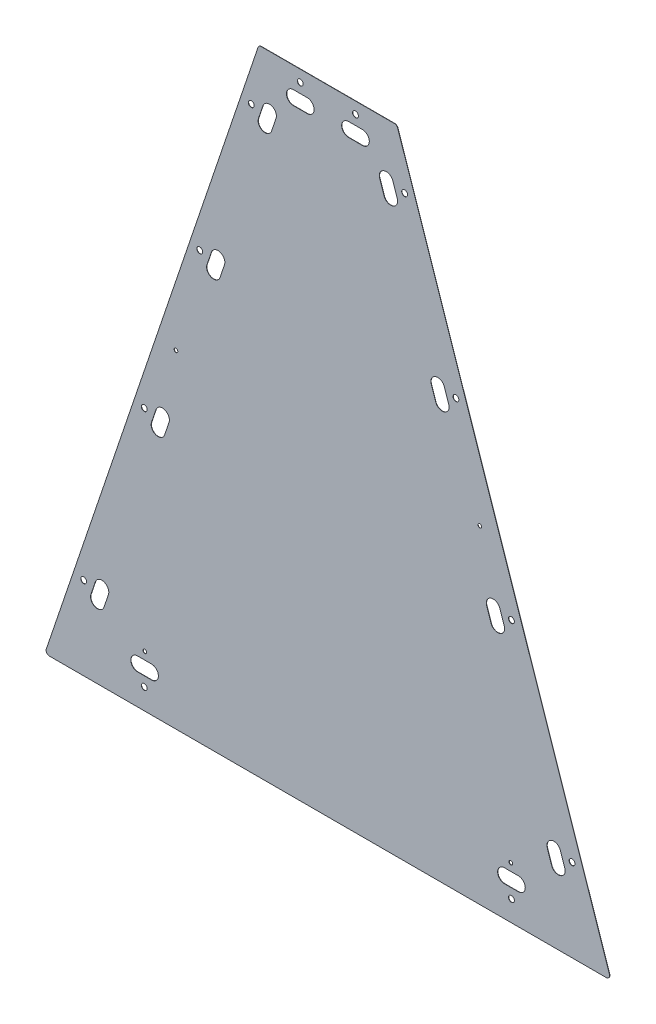
from build123d import *

# Parameters (mm, degrees)
GE_24334_OUTLINE_R   = 5.3578125
GE_24334_OUTLINE_R_2 = 3.373501
GE_24334_DEPTH       = 6.35
SKETCH1_W            = 1036.405519013
SKETCH1_H            = 5.842
CUT_EXTRUDE1_DEPTH   = 1400.059095494


# Read off the part's stored shape, not the designer's step: GE-24334
with BuildPart() as part:
    # GE-24334 outline → GE-24334 (new body)
    with BuildSketch(Plane.XY):
        with BuildLine():
            ThreePointArc((133.104268735, 292.971606529), (129.401623275, 291.780377371), (127.088174424, 288.653627505))
            Line((127.088174424, 288.653627505), (-262.322220882, -864.25261299))
            ThreePointArc((-262.322220882, -864.25261299), (-261.464897413, -869.987279425), (-256.306126571, -872.634633965))
            Line((-256.306126571, -872.634633965), (767.399392442, -872.634633965))
            ThreePointArc((767.399392442, -872.634633965), (772.558163284, -869.987279425), (773.415486753, -864.25261299))
            Line((773.415486753, -864.25261299), (384.005091446, 288.653627505))
            ThreePointArc((384.005091446, 288.653627505), (381.691642596, 291.780377371), (377.988997136, 292.971606529))
            Line((377.988997136, 292.971606529), (133.104268735, 292.971606529))
        make_face()
        with BuildLine():
            Line((-180.239726648, -736.327985402), (-172.111642745, -712.26360816))
            ThreePointArc((-172.111642745, -712.26360816), (-156.015412172, -704.29546149), (-148.047265502, -720.391692063))
            Line((-148.047265502, -720.391692063), (-156.175349405, -744.456069305))
            ThreePointArc((-156.175349405, -744.456069305), (-172.271579978, -752.424215975), (-180.239726648, -736.327985402))
        make_face(mode=Mode.SUBTRACT)
        with Locations((-82.126785136, -834.534633965)):
            Circle(GE_24334_OUTLINE_R, mode=Mode.SUBTRACT)
        with BuildLine():
            Line((-94.231734473, -791.354633965), (-68.831734473, -791.354633965))
            ThreePointArc((-68.831734473, -791.354633965), (-56.131734473, -804.054633965), (-68.831734473, -816.754633965))
            Line((-68.831734473, -816.754633965), (-94.231734473, -816.754633965))
            ThreePointArc((-94.231734473, -816.754633965), (-106.931734473, -804.054633965), (-94.231734473, -791.354633965))
        make_face(mode=Mode.SUBTRACT)
        with Locations((-81.003367065, -777.384633965)):
            Circle(GE_24334_OUTLINE_R_2, mode=Mode.SUBTRACT)
        with Locations((-193.570796303, -720.234633965)):
            Circle(GE_24334_OUTLINE_R, mode=Mode.SUBTRACT)
        with Locations((-82.126785136, -390.288393471)):
            Circle(GE_24334_OUTLINE_R, mode=Mode.SUBTRACT)
        with BuildLine():
            Line((-68.772097635, -406.311820835), (-60.644013732, -382.247443592))
            ThreePointArc((-60.644013732, -382.247443592), (-44.54778316, -374.279296923), (-36.57963649, -390.375527495))
            Line((-36.57963649, -390.375527495), (-44.707720392, -414.439904738))
            ThreePointArc((-44.707720392, -414.439904738), (-60.803950965, -422.408051408), (-68.772097635, -406.311820835))
        make_face(mode=Mode.SUBTRACT)
        with Locations((593.220051006, -834.534633965)):
            Circle(GE_24334_OUTLINE_R, mode=Mode.SUBTRACT)
        with BuildLine():
            Line((580.520051006, -791.354633965), (605.920051006, -791.354633965))
            ThreePointArc((605.920051006, -791.354633965), (618.620051006, -804.054633965), (605.920051006, -816.754633965))
            Line((605.920051006, -816.754633965), (580.520051006, -816.754633965))
            ThreePointArc((580.520051006, -816.754633965), (567.820051006, -804.054633965), (580.520051006, -791.354633965))
        make_face(mode=Mode.SUBTRACT)
        with Locations((592.096632935, -777.384633965)):
            Circle(GE_24334_OUTLINE_R_2, mode=Mode.SUBTRACT)
        with BuildLine():
            Line((667.268615276, -744.456069305), (659.140531373, -720.391692063))
            ThreePointArc((659.140531373, -720.391692063), (667.108678043, -704.29546149), (683.204908616, -712.26360816))
            Line((683.204908616, -712.26360816), (691.332992518, -736.327985402))
            ThreePointArc((691.332992518, -736.327985402), (683.364845849, -752.424215975), (667.268615276, -744.456069305))
        make_face(mode=Mode.SUBTRACT)
        with Locations((704.664062174, -720.234633965)):
            Circle(GE_24334_OUTLINE_R, mode=Mode.SUBTRACT)
        with BuildLine():
            Line((555.800986263, -414.439904738), (547.67290236, -390.375527495))
            ThreePointArc((547.67290236, -390.375527495), (555.64104903, -374.279296923), (571.737279603, -382.247443592))
            Line((571.737279603, -382.247443592), (579.865363506, -406.311820835))
            ThreePointArc((579.865363506, -406.311820835), (571.897216836, -422.408051408), (555.800986263, -414.439904738))
        make_face(mode=Mode.SUBTRACT)
        with Locations((593.220051006, -390.288393471)):
            Circle(GE_24334_OUTLINE_R, mode=Mode.SUBTRACT)
        with Locations((-23.853367065, -269.384633965)):
            Circle(GE_24334_OUTLINE_R_2, mode=Mode.SUBTRACT)
        with Locations((19.96580657, -88.028393471)):
            Circle(GE_24334_OUTLINE_R, mode=Mode.SUBTRACT)
        with BuildLine():
            Line((33.202373314, -104.401534553), (41.330457217, -80.33715731))
            ThreePointArc((41.330457217, -80.33715731), (57.42668779, -72.36901064), (65.394834459, -88.465241213))
            Line((65.394834459, -88.465241213), (57.266750557, -112.529618456))
            ThreePointArc((57.266750557, -112.529618456), (41.170519984, -120.497765125), (33.202373314, -104.401534553))
        make_face(mode=Mode.SUBTRACT)
        with Locations((114.659199441, 192.325199783)):
            Circle(GE_24334_OUTLINE_R, mode=Mode.SUBTRACT)
        with BuildLine():
            Line((127.949253412, 176.110415433), (136.077337315, 200.174792676))
            ThreePointArc((136.077337315, 200.174792676), (152.173567887, 208.142939345), (160.141714557, 192.046708773))
            Line((160.141714557, 192.046708773), (152.013630654, 167.98233153))
            ThreePointArc((152.013630654, 167.98233153), (135.917400081, 160.01418486), (127.949253412, 176.110415433))
        make_face(mode=Mode.SUBTRACT)
        with BuildLine():
            Line((192.113515822, 253.947158802), (217.513515822, 253.947158802))
            ThreePointArc((217.513515822, 253.947158802), (230.213515822, 241.247158802), (217.513515822, 228.547158802))
            Line((217.513515822, 228.547158802), (192.113515822, 228.547158802))
            ThreePointArc((192.113515822, 228.547158802), (179.413515822, 241.247158802), (192.113515822, 253.947158802))
        make_face(mode=Mode.SUBTRACT)
        with Locations((204.746632935, 271.727158802)):
            Circle(GE_24334_OUTLINE_R, mode=Mode.SUBTRACT)
        with BuildLine():
            Line((453.826515314, -112.529618456), (445.698431411, -88.465241213))
            ThreePointArc((445.698431411, -88.465241213), (453.666578081, -72.36901064), (469.762808654, -80.33715731))
            Line((469.762808654, -80.33715731), (477.890892557, -104.401534553))
            ThreePointArc((477.890892557, -104.401534553), (469.922745887, -120.497765125), (453.826515314, -112.529618456))
        make_face(mode=Mode.SUBTRACT)
        with Locations((491.127459301, -88.028393471)):
            Circle(GE_24334_OUTLINE_R, mode=Mode.SUBTRACT)
        with Locations((534.946632935, -269.384633965)):
            Circle(GE_24334_OUTLINE_R_2, mode=Mode.SUBTRACT)
        with BuildLine():
            Line((359.065010443, 168.025630302), (350.936926541, 192.090007545))
            ThreePointArc((350.936926541, 192.090007545), (358.90507321, 208.186238118), (375.001303783, 200.218091448))
            Line((375.001303783, 200.218091448), (383.129387686, 176.153714205))
            ThreePointArc((383.129387686, 176.153714205), (375.161241016, 160.057483633), (359.065010443, 168.025630302))
        make_face(mode=Mode.SUBTRACT)
        with BuildLine():
            Line((293.646632935, 253.947158802), (319.046632935, 253.947158802))
            ThreePointArc((319.046632935, 253.947158802), (331.746632935, 241.247158802), (319.046632935, 228.547158802))
            Line((319.046632935, 228.547158802), (293.646632935, 228.547158802))
            ThreePointArc((293.646632935, 228.547158802), (280.946632935, 241.247158802), (293.646632935, 253.947158802))
        make_face(mode=Mode.SUBTRACT)
        with Locations((306.346632935, 271.727158802)):
            Circle(GE_24334_OUTLINE_R, mode=Mode.SUBTRACT)
        with Locations((396.756156044, 191.371606529)):
            Circle(GE_24334_OUTLINE_R, mode=Mode.SUBTRACT)
    extrude(amount=GE_24334_DEPTH)

    # Sketch1 → Cut-Extrude1 (cut, through all)
    with BuildSketch(Plane.XZ.offset(872.634633965)):
        with Locations((255.546632936, 3.429)):
            Rectangle(SKETCH1_W, SKETCH1_H)
    extrude(amount=-CUT_EXTRUDE1_DEPTH, mode=Mode.SUBTRACT)


solid = part.part
